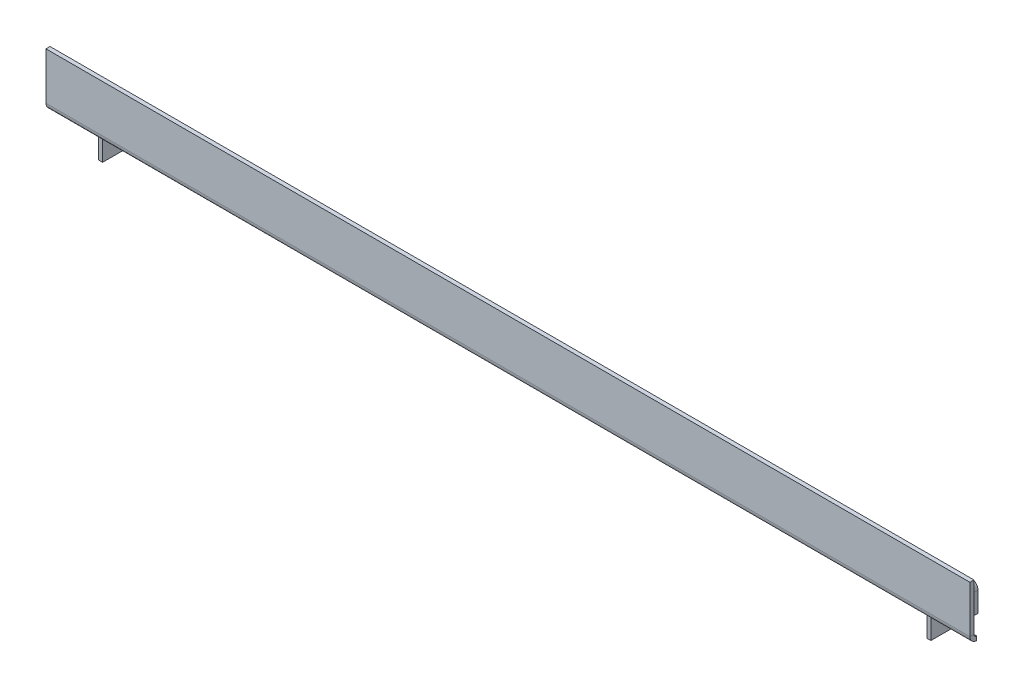
from build123d import *

# Parameters (mm, degrees)
SKETCH_1_W                       = 343
SKETCH_1_H                       = 18.5
EXTRUDE_1_DEPTH                  = 2
SHEET_METAL_1_OUTLINE_W          = 343
SHEET_METAL_1_OUTLINE_H          = 18.5
SHEET_METAL_1_DEPTH              = 0.5
SM_EDGE_FLANGE_1_STRIP_W         = 8
SM_EDGE_FLANGE_1_STRIP_H         = 1.5
SM_EDGE_FLANGE_1_STRIP_CUT_DEPTH = 343
SM_EDGE_FLANGE_1_DEPTH           = 343
SM_EDGE_FLANGE_2_STRIP_W         = 26.5
SM_EDGE_FLANGE_2_STRIP_H         = 1.5
SM_EDGE_FLANGE_2_STRIP_CUT_DEPTH = 17.5
SM_EDGE_FLANGE_2_DEPTH           = 17.5
SM_EDGE_FLANGE_3_STRIP_W         = 26.5
SM_EDGE_FLANGE_3_STRIP_H         = 1.5
SM_EDGE_FLANGE_3_STRIP_CUT_DEPTH = 17.5
SM_EDGE_FLANGE_3_DEPTH           = 17.5


# Read off the part's stored shape, not the designer's step: Преобразовать-Твердое тело1
# Sheet-metal steps are written as plain solids
with BuildPart() as part:
    # Sketch 1 → Бобышка-Вытянуть1 (new body)
    with BuildSketch(Plane(origin=(0, 0, 0), x_dir=(1, 0, 0), z_dir=(0, 1, 0))):
        with Locations((171.5, 9.25)):
            Rectangle(SKETCH_1_W, SKETCH_1_H)
    extrude(amount=EXTRUDE_1_DEPTH)

    # Sheet Metal 1 outline → Sheet Metal 1 (cut)
    with BuildSketch(Plane(origin=(0, 0, 0), x_dir=(1, 0, 0), z_dir=(0, 1, 0))):
        with Locations((171.5, 9.25)):
            Rectangle(SHEET_METAL_1_OUTLINE_W, SHEET_METAL_1_OUTLINE_H)
    extrude(amount=SHEET_METAL_1_DEPTH, mode=Mode.SUBTRACT)

    # Ребро-кромка1 strip (across the edge) → Ребро-кромка1 strip cut (cut)
    with BuildSketch(Plane(origin=(0, 2, 0), x_dir=(0, 0, -1), z_dir=(1, 0, 0))):
        with Locations((-3, -0.75)):
            Rectangle(SM_EDGE_FLANGE_1_STRIP_W, SM_EDGE_FLANGE_1_STRIP_H)
    extrude(amount=SM_EDGE_FLANGE_1_STRIP_CUT_DEPTH, mode=Mode.SUBTRACT)

    # Ребро-кромка1 section (across the edge) → Ребро-кромка1 (add)
    with BuildSketch(Plane(origin=(0, 2, 0), x_dir=(0, 0, -1), z_dir=(1, 0, 0))):
        with BuildLine():
            Line((-1.5, 1), (-1.5, 18.5))
            Line((-1.5, 18.5), (0, 18.5))
            Line((0, 18.5), (0, 1))
            ThreePointArc((0, 1), (0.292893219, 0.292893219), (1, 0))
            Line((1, 0), (1, -1.5))
            ThreePointArc((1, -1.5), (-0.767766953, -0.767766953), (-1.5, 1))
        make_face()
    extrude(amount=SM_EDGE_FLANGE_1_DEPTH)

    # Ребро-кромка2 strip (across the edge) → Ребро-кромка2 strip cut (cut)
    with BuildSketch(Plane(origin=(18.5, 0.5, -1), x_dir=(1, 0, 0), z_dir=(0, 0, -1))):
        with Locations((-12.25, -0.75)):
            Rectangle(SM_EDGE_FLANGE_2_STRIP_W, SM_EDGE_FLANGE_2_STRIP_H)
    extrude(amount=SM_EDGE_FLANGE_2_STRIP_CUT_DEPTH, mode=Mode.SUBTRACT)

    # Ребро-кромка2 section (across the edge) → Ребро-кромка2 (add)
    with BuildSketch(Plane(origin=(18.5, 0.5, -1), x_dir=(1, 0, 0), z_dir=(0, 0, -1))):
        with BuildLine():
            Line((-1.5, 1), (-1.5, 8.5))
            Line((-1.5, 8.5), (0, 8.5))
            Line((0, 8.5), (0, 1))
            ThreePointArc((0, 1), (0.292893219, 0.292893219), (1, 0))
            Line((1, 0), (1, -1.5))
            ThreePointArc((1, -1.5), (-0.767766953, -0.767766953), (-1.5, 1))
        make_face()
    extrude(amount=SM_EDGE_FLANGE_2_DEPTH)

    # Ребро-кромка3 strip (across the edge) → Ребро-кромка3 strip cut (cut)
    with BuildSketch(Plane(origin=(324.5, 0.5, -18.5), x_dir=(-1, 0, 0), z_dir=(0, 0, 1))):
        with Locations((-12.25, -0.75)):
            Rectangle(SM_EDGE_FLANGE_3_STRIP_W, SM_EDGE_FLANGE_3_STRIP_H)
    extrude(amount=SM_EDGE_FLANGE_3_STRIP_CUT_DEPTH, mode=Mode.SUBTRACT)

    # Ребро-кромка3 section (across the edge) → Ребро-кромка3 (add)
    with BuildSketch(Plane(origin=(324.5, 0.5, -18.5), x_dir=(-1, 0, 0), z_dir=(0, 0, 1))):
        with BuildLine():
            Line((-1.5, 1), (-1.5, 8.5))
            Line((-1.5, 8.5), (0, 8.5))
            Line((0, 8.5), (0, 1))
            ThreePointArc((0, 1), (0.292893219, 0.292893219), (1, 0))
            Line((1, 0), (1, -1.5))
            ThreePointArc((1, -1.5), (-0.767766953, -0.767766953), (-1.5, 1))
        make_face()
    extrude(amount=SM_EDGE_FLANGE_3_DEPTH)


solid = part.part
